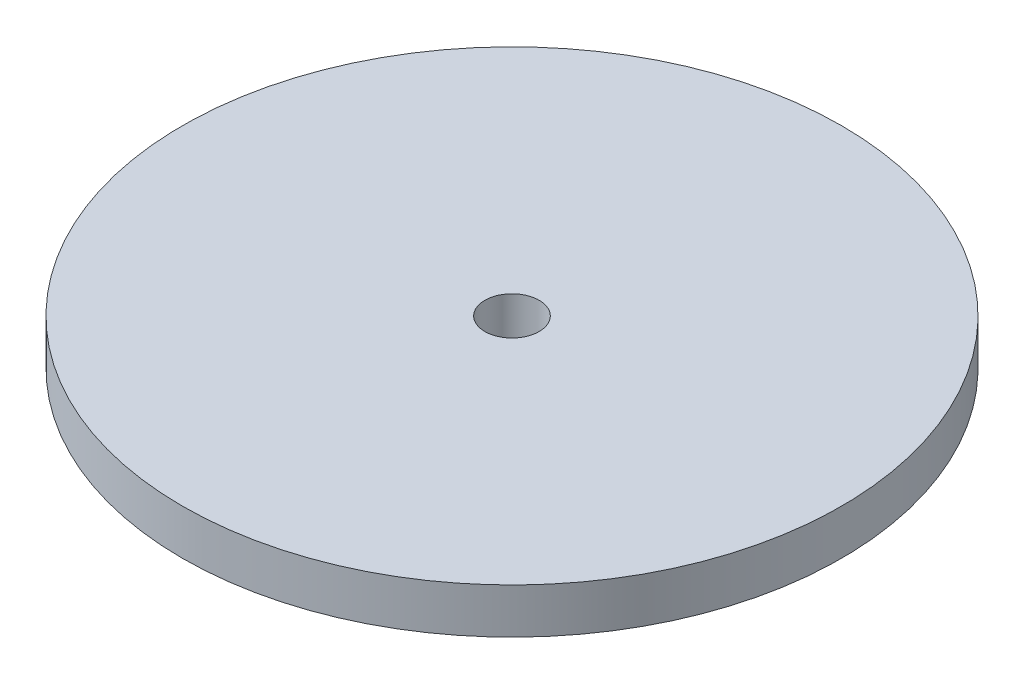
from build123d import *

# Parameters (mm, degrees)
SKETCH1_R           = 36.45
SKETCH1_R_2         = 3
BOSS_EXTRUDE1_DEPTH = 5


with BuildPart() as part:
    # Sketch1 → Boss-Extrude1 (new body)
    with BuildSketch(Plane(origin=(0, 0, 0), x_dir=(1, 0, 0), z_dir=(0, 1, 0))):
        Circle(SKETCH1_R)
        Circle(SKETCH1_R_2, mode=Mode.SUBTRACT)
    extrude(amount=BOSS_EXTRUDE1_DEPTH)


solid = part.part
